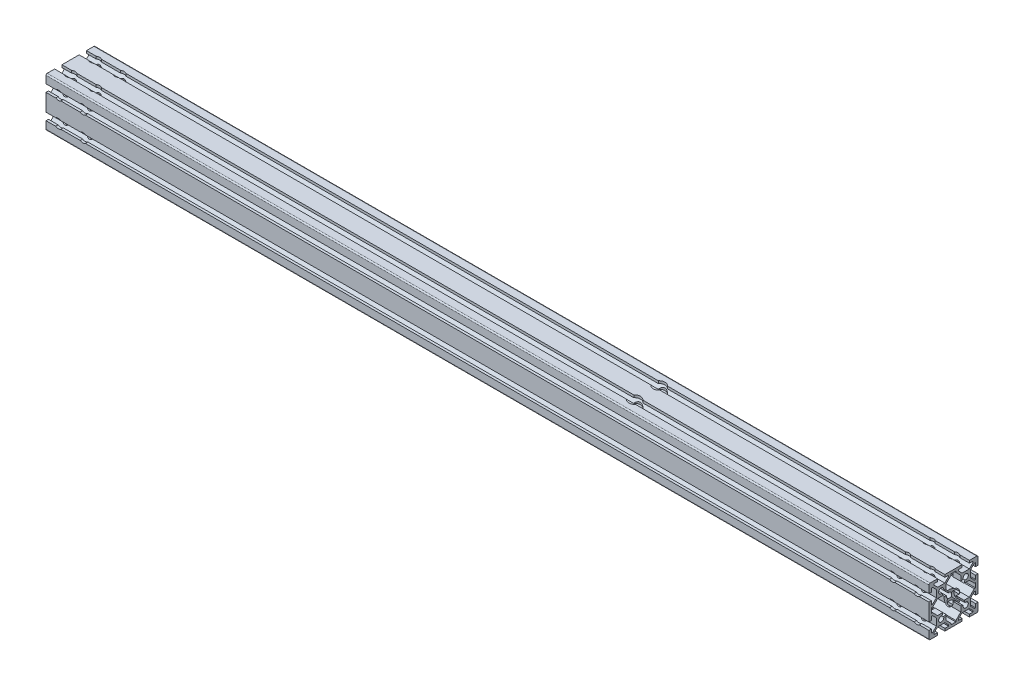
from build123d import *

# Parameters (mm, degrees)
BOSS_EXTRUDE1_DEPTH = 720
SKETCH44_R          = 3.675
CUT_EXTRUDE17_DEPTH = 40
SKETCH45_R          = 3.675
CUT_EXTRUDE18_DEPTH = 40
SKETCH56_R          = 3.675
CUT_EXTRUDE29_DEPTH = 40
SKETCH57_R          = 3.675
CUT_EXTRUDE30_DEPTH = 40
LPATTERN1_COUNT     = 2
LPATTERN1_PITCH     = 20


with BuildPart() as part:
    # Sketch1 → Boss-Extrude1 (new body)
    with BuildSketch(Plane(origin=(0, 0, 0), x_dir=(0, 0, -1), z_dir=(1, 0, 0))):
        with BuildLine():
            Line((-20, 19), (-20, 13))
            Line((-20, 13), (-18, 13))
            Line((-18, 13), (-18, 16))
            Line((-18, 16), (-17.060660172, 16))
            Line((-17.060660172, 16), (-14, 12.939339828))
            Line((-14, 12.939339828), (-14, 7.060660172))
            Line((-14, 7.060660172), (-17.060660172, 4))
            Line((-17.060660172, 4), (-18, 4))
            Line((-18, 4), (-18, 7))
            Line((-18, 7), (-20, 7))
            Line((-20, 7), (-20, -7))
            Line((-20, -7), (-18, -7))
            Line((-18, -7), (-18, -4))
            Line((-18, -4), (-17.060660172, -4))
            Line((-17.060660172, -4), (-14, -7.060660172))
            Line((-14, -7.060660172), (-14, -12.939339828))
            Line((-14, -12.939339828), (-17.060660172, -16))
            Line((-17.060660172, -16), (-18, -16))
            Line((-18, -16), (-18, -13))
            Line((-18, -13), (-20, -13))
            Line((-20, -13), (-20, -19))
            ThreePointArc((-20, -19), (-19.707106781, -19.707106781), (-19, -20))
            Line((-19, -20), (-13, -20))
            Line((-13, -20), (-13, -18))
            Line((-13, -18), (-16, -18))
            Line((-16, -18), (-16, -17.060660172))
            Line((-16, -17.060660172), (-12.939339828, -14))
            Line((-12.939339828, -14), (-7.060660172, -14))
            Line((-7.060660172, -14), (-4, -17.060660172))
            Line((-4, -17.060660172), (-4, -18))
            Line((-4, -18), (-7, -18))
            Line((-7, -18), (-7, -20))
            Line((-7, -20), (7, -20))
            Line((7, -20), (7, -18))
            Line((7, -18), (4, -18))
            Line((4, -18), (4, -17.060660172))
            Line((4, -17.060660172), (7.060660172, -14))
            Line((7.060660172, -14), (12.939339828, -14))
            Line((12.939339828, -14), (16, -17.060660172))
            Line((16, -17.060660172), (16, -18))
            Line((16, -18), (13, -18))
            Line((13, -18), (13, -20))
            Line((13, -20), (19, -20))
            ThreePointArc((19, -20), (19.707106781, -19.707106781), (20, -19))
            Line((20, -19), (20, -13))
            Line((20, -13), (18, -13))
            Line((18, -13), (18, -16))
            Line((18, -16), (17.060660172, -16))
            Line((17.060660172, -16), (14, -12.939339828))
            Line((14, -12.939339828), (14, -7.060660172))
            Line((14, -7.060660172), (17.060660172, -4))
            Line((17.060660172, -4), (18, -4))
            Line((18, -4), (18, -7))
            Line((18, -7), (20, -7))
            Line((20, -7), (20, 7))
            Line((20, 7), (18, 7))
            Line((18, 7), (18, 4))
            Line((18, 4), (17.060660172, 4))
            Line((17.060660172, 4), (14, 7.060660172))
            Line((14, 7.060660172), (14, 12.939339828))
            Line((14, 12.939339828), (17.060660172, 16))
            Line((17.060660172, 16), (18, 16))
            Line((18, 16), (18, 13))
            Line((18, 13), (20, 13))
            Line((20, 13), (20, 19))
            ThreePointArc((20, 19), (19.707106781, 19.707106781), (19, 20))
            Line((19, 20), (13, 20))
            Line((13, 20), (13, 18))
            Line((13, 18), (16, 18))
            Line((16, 18), (16, 17.060660172))
            Line((16, 17.060660172), (12.939339828, 14))
            Line((12.939339828, 14), (7.060660172, 14))
            Line((7.060660172, 14), (4, 17.060660172))
            Line((4, 17.060660172), (4, 18))
            Line((4, 18), (7, 18))
            Line((7, 18), (7, 20))
            Line((7, 20), (-7, 20))
            Line((-7, 20), (-7, 18))
            Line((-7, 18), (-4, 18))
            Line((-4, 18), (-4, 17.060660172))
            Line((-4, 17.060660172), (-7.060660172, 14))
            Line((-7.060660172, 14), (-12.939339828, 14))
            Line((-12.939339828, 14), (-16, 17.060660172))
            Line((-16, 17.060660172), (-16, 18))
            Line((-16, 18), (-13, 18))
            Line((-13, 18), (-13, 20))
            Line((-13, 20), (-19, 20))
            ThreePointArc((-19, 20), (-19.707106781, 19.707106781), (-20, 19))
        make_face()
        with BuildLine():
            Line((-16.939339828, 2), (-18, 2))
            Line((-18, 2), (-18, -2))
            Line((-18, -2), (-16.939339828, -2))
            Line((-16.939339828, -2), (-12.939339828, -6))
            Line((-12.939339828, -6), (-8.666662697, -6))
            Line((-8.666662697, -6), (-9.335919912, -8.007765667))
            ThreePointArc((-9.335919912, -8.007765667), (-11.48492424, -11.48492424), (-8.007765667, -9.335919912))
            Line((-8.007765667, -9.335919912), (-6, -8.666662697))
            Line((-6, -8.666662697), (-6, -12.939339828))
            Line((-6, -12.939339828), (-2, -16.939339828))
            Line((-2, -16.939339828), (-2, -18))
            Line((-2, -18), (2, -18))
            Line((2, -18), (2, -16.939339828))
            Line((2, -16.939339828), (6, -12.939339828))
            Line((6, -12.939339828), (6, -8.666662697))
            Line((6, -8.666662697), (8.007765667, -9.335919912))
            ThreePointArc((8.007765667, -9.335919912), (11.48492424, -11.48492424), (9.335919912, -8.007765667))
            Line((9.335919912, -8.007765667), (8.666662697, -6))
            Line((8.666662697, -6), (12.939339828, -6))
            Line((12.939339828, -6), (16.939339828, -2))
            Line((16.939339828, -2), (18, -2))
            Line((18, -2), (18, 2))
            Line((18, 2), (16.939339828, 2))
            Line((16.939339828, 2), (12.939339828, 6))
            Line((12.939339828, 6), (8.666662697, 6))
            Line((8.666662697, 6), (9.335919912, 8.007765667))
            ThreePointArc((9.335919912, 8.007765667), (11.48492424, 11.48492424), (8.007765667, 9.335919912))
            Line((8.007765667, 9.335919912), (6, 8.666662697))
            Line((6, 8.666662697), (6, 12.939339828))
            Line((6, 12.939339828), (2, 16.939339828))
            Line((2, 16.939339828), (2, 18))
            Line((2, 18), (-2, 18))
            Line((-2, 18), (-2, 16.939339828))
            Line((-2, 16.939339828), (-6, 12.939339828))
            Line((-6, 12.939339828), (-6, 8.666662697))
            Line((-6, 8.666662697), (-8.007765667, 9.335919912))
            ThreePointArc((-8.007765667, 9.335919912), (-11.48492424, 11.48492424), (-9.335919912, 8.007765667))
            Line((-9.335919912, 8.007765667), (-8.666662697, 6))
            Line((-8.666662697, 6), (-12.939339828, 6))
            Line((-12.939339828, 6), (-16.939339828, 2))
        make_face(mode=Mode.SUBTRACT)
    extrude(amount=BOSS_EXTRUDE1_DEPTH)

    # Sketch44 → Cut-Extrude17 (cut)
    with BuildSketch(Plane.XY.offset(20)):
        with Locations(Location((10, 10, 0), (0, 0, 53.112951556))):
            Circle(SKETCH44_R)
        with Locations(Location((30, 10, 0), (0, 0, 53.112951556))):
            Circle(SKETCH44_R)
        with Locations(Location((10, -10, 0), (0, 0, 306.887048444))):
            Circle(SKETCH44_R)
        with Locations(Location((30, -10, 0), (0, 0, 306.887048444))):
            Circle(SKETCH44_R)
    extrude(amount=-CUT_EXTRUDE17_DEPTH, mode=Mode.SUBTRACT)

    # Sketch45 → Cut-Extrude18 (cut)
    with BuildSketch(Plane(origin=(0, 20, 0), x_dir=(1, 0, 0), z_dir=(0, 1, 0))):
        with Locations(Location((10, -10, 0), (0, 0, 306.887048444))):
            Circle(SKETCH45_R)
        with Locations(Location((30, -10, 0), (0, 0, 306.887048444))):
            Circle(SKETCH45_R)
        with Locations(Location((10, 10, 0), (0, 0, 306.887048444))):
            Circle(SKETCH45_R)
        with Locations(Location((30, 10, 0), (0, 0, 306.887048444))):
            Circle(SKETCH45_R)
    extrude(amount=-CUT_EXTRUDE18_DEPTH, mode=Mode.SUBTRACT)

    # Sketch56 → Cut-Extrude29 (cut)
    with BuildSketch(Plane.XY.offset(20)):
        with Locations(Location((710, -10, 0), (0, 0, 306.887048444))):
            Circle(SKETCH56_R)
        with Locations(Location((690, -10, 0), (0, 0, 306.887048444))):
            Circle(SKETCH56_R)
        with Locations(Location((690, 10, 0), (0, 0, 53.112951556))):
            Circle(SKETCH56_R)
        with Locations(Location((710, 10, 0), (0, 0, 53.112951556))):
            Circle(SKETCH56_R)
    extrude(amount=-CUT_EXTRUDE29_DEPTH, mode=Mode.SUBTRACT)

    # Sketch57 → Cut-Extrude30 (cut)
    with BuildSketch(Plane(origin=(0, 20, 0), x_dir=(1, 0, 0), z_dir=(0, 1, 0))):
        with Locations(Location((710, -10, 0), (0, 0, 233.112951556))):
            Circle(SKETCH57_R)
        with Locations(Location((690, -10, 0), (0, 0, 233.112951556))):
            Circle(SKETCH57_R)
        with Locations(Location((690, 10, 0), (0, 0, 233.112951556))):
            Circle(SKETCH57_R)
        with Locations(Location((710, 10, 0), (0, 0, 233.112951556))):
            Circle(SKETCH57_R)
    extrude(amount=-CUT_EXTRUDE30_DEPTH, mode=Mode.SUBTRACT)

    # Sketch80 → Cut-Revolve1 (revolve, cut)
    with BuildSketch(Plane(origin=(470, 0, 0), x_dir=(0, 0, -1), z_dir=(1, 0, 0)), mode=Mode.PRIVATE) as cut_revolve1_sk:
        Polygon((10, -20), (12.75, -20), (12.75, 14), (14.75, 14), (14.75, 20), (10, 20), align=None)
    cut_revolve1 = revolve(cut_revolve1_sk.sketch.rotate(Axis((470, 20, -10), (0, -1, 0)), 180), axis=Axis((470, 20, -10), (0, -1, 0)), mode=Mode.SUBTRACT)

    # LPattern1: Cut-Revolve1 ×2
    with Locations(*[(0, 0, i * LPATTERN1_PITCH) for i in range(1, LPATTERN1_COUNT)]):
        add(cut_revolve1, mode=Mode.SUBTRACT)


solid = part.part
